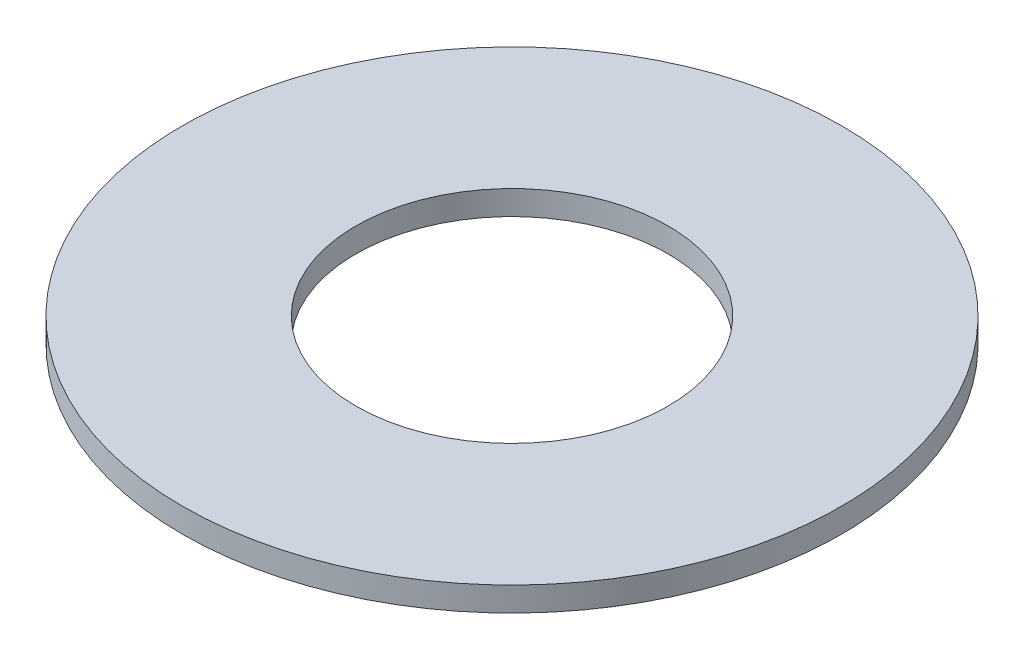
from build123d import *

# Parameters (mm, degrees)
SKETCH1_R           = 95
BOSS_EXTRUDE1_DEPTH = 7
SKETCH2_R           = 45
CUT_EXTRUDE1_DEPTH  = 135.532523949


with BuildPart() as part:
    # Sketch1 → Boss-Extrude1 (new body)
    with BuildSketch(Plane(origin=(0, 0, 0), x_dir=(1, 0, 0), z_dir=(0, 1, 0))):
        Circle(SKETCH1_R)
    extrude(amount=BOSS_EXTRUDE1_DEPTH)

    # Sketch2 → Cut-Extrude1 (cut, through all)
    with BuildSketch(Plane(origin=(0, 0, 0), x_dir=(1, 0, 0), z_dir=(0, 1, 0))):
        Circle(SKETCH2_R)
    extrude(amount=CUT_EXTRUDE1_DEPTH, mode=Mode.SUBTRACT)


solid = part.part
